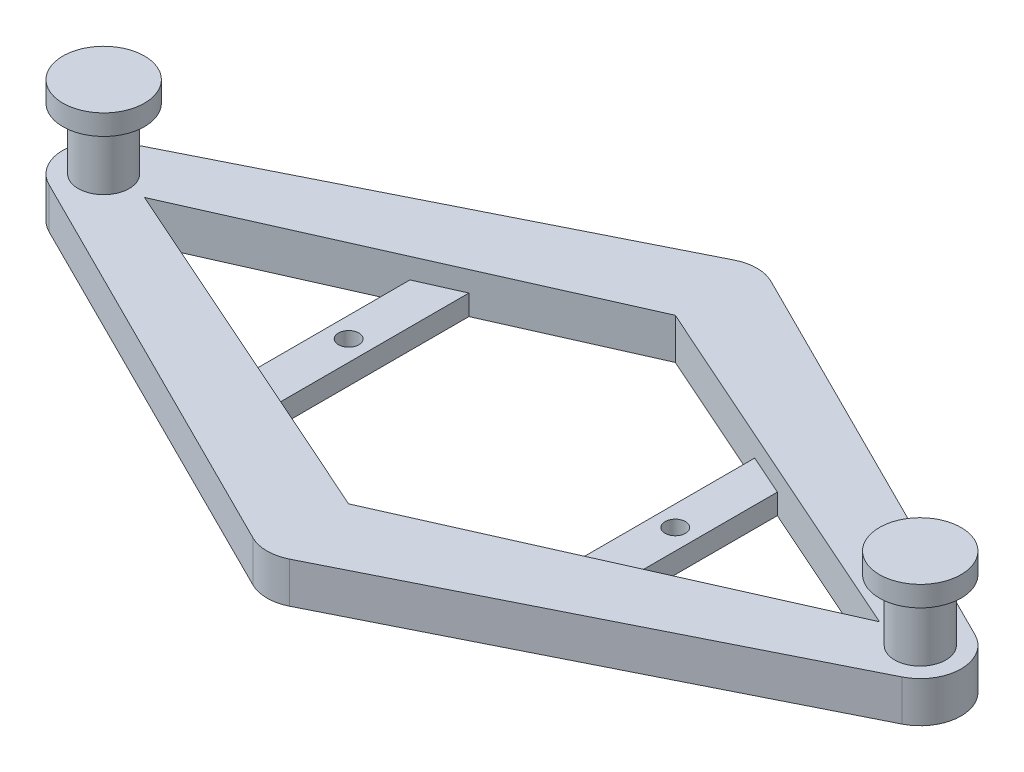
from build123d import *

# Parameters (mm, degrees)
SKETCH5_R             = 1.27
BOSS_EXTRUDE2_DEPTH   = 2.54
BOSS_EXTRUDE2_2_DEPTH = 2.54
BOSS_EXTRUDE1_DEPTH   = 5.08
SKETCH6_R             = 3.175
BOSS_EXTRUDE3_DEPTH   = 7.62
SKETCH11_R            = 5.08
BOSS_EXTRUDE4_DEPTH   = 2.54
SKETCH13_R            = 5.08
BOSS_EXTRUDE5_DEPTH   = 2.54


with BuildPart() as part:
    # Sketch5 → Boss-Extrude2 (new body)
    with BuildSketch(Plane(origin=(0, 0, 0), x_dir=(1, 0, 0), z_dir=(0, 1, 0))):
        Polygon((-22.86, 10.16), (-22.86, -10.16), (-17.78, -12.417777778), (-17.78, 12.417777778), align=None)
        with Locations((-20.32, 0)):
            Circle(SKETCH5_R, mode=Mode.SUBTRACT)
    extrude(amount=BOSS_EXTRUDE2_DEPTH)



with BuildPart() as body_2:
    # Sketch5 → Boss-Extrude2 2 (new body)
    with BuildSketch(Plane(origin=(0, 0, 0), x_dir=(1, 0, 0), z_dir=(0, 1, 0))):
        Polygon((22.86, 10.16), (17.78, 12.417777778), (17.78, -12.417777778), (22.86, -10.16), align=None)
        with Locations((20.32, 0)):
            Circle(SKETCH5_R, mode=Mode.SUBTRACT)
    extrude(amount=BOSS_EXTRUDE2_2_DEPTH)


with BuildPart() as part_1:
    add(part.part)

    add(body_2.part)  # Boss-Extrude1 merges body 2
    # Sketch2 → Boss-Extrude1 (add)
    with BuildSketch(Plane(origin=(0, 0, 0), x_dir=(1, 0, 0), z_dir=(0, 1, 0))):
        with BuildLine():
            Line((-53.071845065, -4.54369013), (-2.271845065, -29.94369013))
            ThreePointArc((-2.271845065, -29.94369013), (0, -30.48), (2.271845065, -29.94369013))
            Line((2.271845065, -29.94369013), (53.071845065, -4.54369013))
            ThreePointArc((53.071845065, -4.54369013), (55.88, 0), (53.071845065, 4.54369013))
            Line((53.071845065, 4.54369013), (2.271845065, 29.94369013))
            ThreePointArc((2.271845065, 29.94369013), (0, 30.48), (-2.271845065, 29.94369013))
            Line((-2.271845065, 29.94369013), (-53.071845065, 4.54369013))
            ThreePointArc((-53.071845065, 4.54369013), (-55.88, 0), (-53.071845065, -4.54369013))
        make_face()
        Polygon((-45.72, 0), (0, 20.32), (45.72, 0), (0, -20.32), align=None, mode=Mode.SUBTRACT)
    extrude(amount=BOSS_EXTRUDE1_DEPTH)

    # Sketch6 → Boss-Extrude3 (add)
    with BuildSketch(Plane(origin=(0, 5.08, 0), x_dir=(1, 0, 0), z_dir=(0, 1, 0))):
        with Locations((-50.8, 0)):
            Circle(SKETCH6_R)
        with Locations((50.8, 0)):
            Circle(SKETCH6_R)
    extrude(amount=BOSS_EXTRUDE3_DEPTH)

    # Sketch11 → Boss-Extrude4 (add)
    with BuildSketch(Plane(origin=(0, 12.7, 0), x_dir=(1, 0, 0), z_dir=(0, 1, 0))):
        with Locations((-50.8, 0)):
            Circle(SKETCH11_R)
    extrude(amount=BOSS_EXTRUDE4_DEPTH)

    # Sketch13 → Boss-Extrude5 (add)
    with BuildSketch(Plane(origin=(0, 12.7, 0), x_dir=(1, 0, 0), z_dir=(0, 1, 0))):
        with Locations((50.8, 0)):
            Circle(SKETCH13_R)
    extrude(amount=BOSS_EXTRUDE5_DEPTH)


solid = part_1.part
